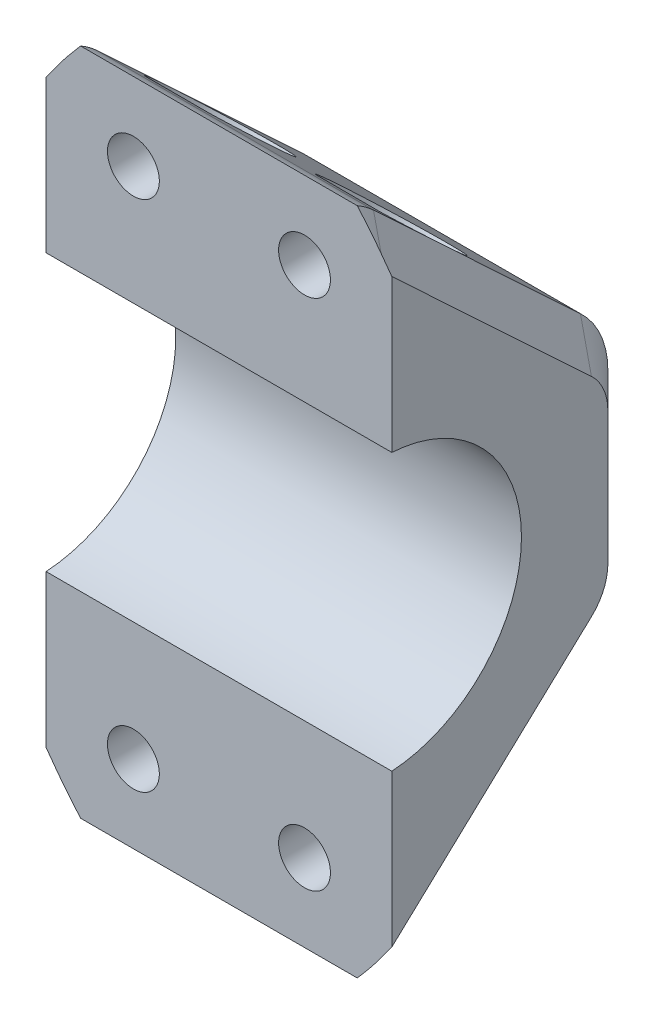
from build123d import *

# Parameters (mm, degrees)
SKETCH2_W           = 20
SKETCH2_H           = 49.6
SKETCH2_R           = 1.5
BOSS_EXTRUDE1_DEPTH = 30
CUT_EXTRUDE1_DEPTH  = 30
CUT_EXTRUDE2_DEPTH  = 22
FILLET1_R           = 5
FILLET2_R           = 2
CHAMFER1_SIZE       = 2
SKETCH5_R           = 3
SKETCH5_R_2         = 1.5
CUT_EXTRUDE3_DEPTH  = 12
CUT_EXTRUDE4_DEPTH  = 23


with BuildPart() as part:
    # Sketch2 → Boss-Extrude1 (new body)
    with BuildSketch(Plane.XY):
        with Locations((20.689228864, 114.541105708)):
            Rectangle(SKETCH2_W, SKETCH2_H)
        with Locations((15.739481395, 99.69135824)):
            Circle(SKETCH2_R, mode=Mode.SUBTRACT)
        with Locations((25.638976332, 99.69135824)):
            Circle(SKETCH2_R, mode=Mode.SUBTRACT)
        with Locations((25.638976332, 129.390853177)):
            Circle(SKETCH2_R, mode=Mode.SUBTRACT)
        with Locations((15.739481395, 129.390853177)):
            Circle(SKETCH2_R, mode=Mode.SUBTRACT)
    extrude(amount=BOSS_EXTRUDE1_DEPTH)

    # Sketch3 → Cut-Extrude1 (cut)
    with BuildSketch(Plane(origin=(30.689228864, 0, 0), x_dir=(0, 0, -1), z_dir=(1, 0, 0))):
        Polygon((-10, 119.541105708), (-18.024193548, 119.541105708), (-11.975806452, 109.541105708), (-10, 109.541105708), align=None)
        Polygon((-11.975806452, 109.541105708), (-18.024193548, 119.541105708), (-20, 119.541105708), (-20, 109.541105708), align=None)
    extrude(amount=-CUT_EXTRUDE1_DEPTH, mode=Mode.SUBTRACT)

    # Sketch4 → Cut-Extrude2 (cut)
    with BuildSketch(Plane(origin=(30.689228864, 0, 0), x_dir=(0, 0, -1), z_dir=(1, 0, 0))):
        Polygon((-30, 139.341105708), (-27.096774194, 134.541105708), (-15, 134.541105708), (0, 134.541105708), (0, 139.341105708), align=None)
        Polygon((-30, 134.541105708), (-27.096774194, 134.541105708), (-30, 139.341105708), align=None)
        Polygon((-15, 134.541105708), (0, 120.541105708), (0, 134.541105708), align=None)
        Polygon((-7.268041237, 101.757600554), (-2.903225806, 94.541105708), (0, 94.541105708), (0, 108.541105708), align=None)
        Polygon((-15, 94.541105708), (-2.903225806, 94.541105708), (-7.268041237, 101.757600554), align=None)
        Polygon((-30, 89.741105708), (0, 89.741105708), (-2.903225806, 94.541105708), (-15, 94.541105708), (-30, 94.541105708), align=None)
        Polygon((-2.903225806, 94.541105708), (0, 89.741105708), (0, 94.541105708), align=None)
    extrude(amount=-CUT_EXTRUDE2_DEPTH, mode=Mode.SUBTRACT)

    # Fillet1
    fillet1_edges = [part.edges().sort_by_distance(p)[0] for p in [
        (20.689228864, 134.541105708, 15),
        (20.689228864, 120.541105708, 0),
        (20.689228864, 94.541105708, 15),
        (20.689228864, 108.541105708, 0),
    ]]
    fillet(fillet1_edges, radius=FILLET1_R)

    # Fillet2
    fillet2_edges = [part.edges().sort_by_distance(p)[0] for p in [
        (20.689228864, 134.541105708, 30),
        (20.689228864, 94.541105708, 30),
    ]]
    fillet(fillet2_edges, radius=FILLET2_R)

    # Chamfer1
    chamfer1_edges = [part.edges().sort_by_distance(p)[0] for p in [
        (30.689228864, 127.610001295, 7.5738167),
        (10.689228864, 127.610001295, 7.5738167),
        (30.689228864, 114.541105708, 0),
        (30.689228864, 101.472210122, 7.5738167),
        (30.689228864, 108.721124919, 0.414263622),
        (30.689228864, 120.361086498, 0.414263622),
        (30.689228864, 94.889418826, 15.137292206),
        (30.689228864, 134.192792591, 15.137292206),
        (10.689228864, 114.541105708, 0),
        (10.689228864, 101.472210122, 7.5738167),
        (10.689228864, 108.721124919, 0.414263622),
        (10.689228864, 120.361086498, 0.414263622),
        (10.689228864, 94.889418826, 15.137292206),
        (10.689228864, 134.192792591, 15.137292206),
        (10.689228864, 114.541105708, 30),
        (30.689228864, 114.541105708, 30),
        (30.689228864, 134.541105708, 22.485407952),
        (30.689228864, 94.541105708, 22.485407952),
        (30.689228864, 133.955319271, 29.414213562),
        (30.689228864, 95.126892146, 29.414213562),
        (10.689228864, 94.541105708, 22.485407952),
        (10.689228864, 134.541105708, 22.485407952),
        (10.689228864, 133.955319271, 29.414213562),
        (10.689228864, 95.126892146, 29.414213562),
    ]]
    chamfer(chamfer1_edges, length=CHAMFER1_SIZE - 0.0001)  # a hair under: the kernel refuses the full size

    # Sketch5 → Cut-Extrude3 (cut)
    # profile 1 of 4: a face of its own
    with BuildSketch(Plane(origin=(0, 0, 0), x_dir=(-1, 0, 0), z_dir=(0, 0, -1))):
        with Locations((-15.739481395, 99.69135824)):
            Circle(SKETCH5_R)
        with Locations((-15.739481395, 99.69135824)):
            Circle(SKETCH5_R_2, mode=Mode.SUBTRACT)
    # profile 2 of 4: a face of its own
    with BuildSketch(Plane(origin=(0, 0, 0), x_dir=(-1, 0, 0), z_dir=(0, 0, -1))):
        with Locations((-25.638976332, 99.69135824)):
            Circle(SKETCH5_R)
        with Locations((-25.638976332, 99.69135824)):
            Circle(SKETCH5_R_2, mode=Mode.SUBTRACT)
    # profile 3 of 4: a face of its own
    with BuildSketch(Plane(origin=(0, 0, 0), x_dir=(-1, 0, 0), z_dir=(0, 0, -1))):
        with Locations((-15.739481395, 129.390853177)):
            Circle(SKETCH5_R)
        with Locations((-15.739481395, 129.390853177)):
            Circle(SKETCH5_R_2, mode=Mode.SUBTRACT)
    # profile 4 of 4: a face of its own
    with BuildSketch(Plane(origin=(0, 0, 0), x_dir=(-1, 0, 0), z_dir=(0, 0, -1))):
        with Locations((-25.638976332, 129.390853177)):
            Circle(SKETCH5_R)
        with Locations((-25.638976332, 129.390853177)):
            Circle(SKETCH5_R_2, mode=Mode.SUBTRACT)
    extrude(amount=-CUT_EXTRUDE3_DEPTH, mode=Mode.SUBTRACT)

    # Sketch6 → Cut-Extrude4 (cut)
    with BuildSketch(Plane.ZY.offset(-10.689228864)):
        with BuildLine():
            ThreePointArc((16.970815903, 96.541105708), (16.478743483, 96.581736733), (16, 96.70252922))
            Line((16, 96.70252922), (16, 91.202832585))
            Line((16, 91.202832585), (39.910531439, 91.202832585))
            Line((39.910531439, 91.202832585), (39.910531439, 137.879378832))
            Line((39.910531439, 137.879378832), (16, 137.879378832))
            Line((16, 137.879378832), (16, 132.379682197))
            ThreePointArc((16, 132.379682197), (16.478743483, 132.500474684), (16.970815903, 132.541105708))
            Line((16.970815903, 132.541105708), (28, 132.541105708))
            Line((28, 132.541105708), (28, 96.541105708))
            Line((28, 96.541105708), (16.970815903, 96.541105708))
        make_face()
        with BuildLine():
            ThreePointArc((23, 114.541105708), (21, 109.249603086), (16, 106.603851775))
            Line((16, 106.603851775), (16, 96.70252922))
            ThreePointArc((16, 96.70252922), (16.478743483, 96.581736733), (16.970815903, 96.541105708))
            Line((16.970815903, 96.541105708), (28, 96.541105708))
            Line((28, 96.541105708), (28, 132.541105708))
            Line((28, 132.541105708), (16.970815903, 132.541105708))
            ThreePointArc((16.970815903, 132.541105708), (16.478743483, 132.500474684), (16, 132.379682197))
            Line((16, 132.379682197), (16, 122.478359641))
            ThreePointArc((16, 122.478359641), (21, 119.83260833), (23, 114.541105708))
        make_face()
        Polygon((20, 119.541105708), (16, 115.541105708), (16, 109.541105708), (20, 109.541105708), align=None)
        Polygon((16, 119.541105708), (16, 115.541105708), (20, 119.541105708), align=None)
        with BuildLine():
            Line((14.5, 109.541105708), (10, 109.541105708))
            Line((10, 109.541105708), (10, 119.541105708))
            Line((10, 119.541105708), (14.5, 119.541105708))
            Line((14.5, 119.541105708), (14.5, 122.52546542))
            ThreePointArc((14.5, 122.52546542), (7, 114.541105708), (14.5, 106.556745997))
            Line((14.5, 106.556745997), (14.5, 109.541105708))
        make_face()
        with BuildLine():
            Line((20, 109.541105708), (16, 109.541105708))
            Line((16, 109.541105708), (16, 106.603851775))
            ThreePointArc((16, 106.603851775), (21, 109.249603086), (23, 114.541105708))
            ThreePointArc((23, 114.541105708), (21, 119.83260833), (16, 122.478359641))
            Line((16, 122.478359641), (16, 119.541105708))
            Line((16, 119.541105708), (20, 119.541105708))
            Line((20, 119.541105708), (20, 109.541105708))
        make_face()
        Polygon((10, 119.541105708), (10, 109.541105708), (14.5, 114.041105708), (14.5, 119.541105708), align=None)
        with BuildLine():
            Line((14.5, 122.52546542), (14.5, 119.541105708))
            Line((14.5, 119.541105708), (15, 119.541105708))
            Line((15, 119.541105708), (15, 122.541105708))
            ThreePointArc((15, 122.541105708), (14.749877721, 122.53719468), (14.5, 122.52546542))
        make_face()
        with BuildLine():
            Line((15, 122.541105708), (15, 119.541105708))
            Line((15, 119.541105708), (16, 119.541105708))
            Line((16, 119.541105708), (16, 122.478359641))
            ThreePointArc((16, 122.478359641), (15.5009833, 122.525403782), (15, 122.541105708))
        make_face()
        Polygon((14.5, 119.541105708), (14.5, 114.041105708), (15, 114.541105708), (15, 119.541105708), align=None)
        Polygon((15, 119.541105708), (15, 114.541105708), (16, 115.541105708), (16, 119.541105708), align=None)
        Polygon((14.5, 114.041105708), (10, 109.541105708), (14.5, 109.541105708), align=None)
        Polygon((15, 114.541105708), (14.5, 114.041105708), (14.5, 109.541105708), (15, 109.541105708), align=None)
        Polygon((16, 115.541105708), (15, 114.541105708), (15, 109.541105708), (16, 109.541105708), align=None)
        with BuildLine():
            Line((15, 109.541105708), (14.5, 109.541105708))
            Line((14.5, 109.541105708), (14.5, 106.556745997))
            ThreePointArc((14.5, 106.556745997), (14.749877721, 106.545016736), (15, 106.541105708))
            Line((15, 106.541105708), (15, 109.541105708))
        make_face()
        with BuildLine():
            Line((16, 109.541105708), (15, 109.541105708))
            Line((15, 109.541105708), (15, 106.541105708))
            ThreePointArc((15, 106.541105708), (15.5009833, 106.556807634), (16, 106.603851775))
            Line((16, 106.603851775), (16, 109.541105708))
        make_face()
        with BuildLine():
            ThreePointArc((15, 106.541105708), (14.749877721, 106.545016736), (14.5, 106.556745997))
            Line((14.5, 106.556745997), (14.5, 97.743543645))
            Line((14.5, 97.743543645), (14.923861152, 97.347939904))
            ThreePointArc((14.923861152, 97.347939904), (14.961637209, 97.313281439), (15, 97.279273558))
            Line((15, 97.279273558), (15, 106.541105708))
        make_face()
        with BuildLine():
            ThreePointArc((16, 106.603851775), (15.5009833, 106.556807634), (15, 106.541105708))
            Line((15, 106.541105708), (15, 97.279273558))
            ThreePointArc((15, 97.279273558), (15.471997059, 96.942347914), (16, 96.70252922))
            Line((16, 96.70252922), (16, 106.603851775))
        make_face()
        with BuildLine():
            Line((14.923861152, 97.347939904), (14.5, 97.743543645))
            Line((14.5, 97.743543645), (14.5, 91.202832585))
            Line((14.5, 91.202832585), (15, 91.202832585))
            Line((15, 91.202832585), (15, 97.279273558))
            ThreePointArc((15, 97.279273558), (14.961637209, 97.313281439), (14.923861152, 97.347939904))
        make_face()
        with BuildLine():
            ThreePointArc((16, 96.70252922), (15.471997059, 96.942347914), (15, 97.279273558))
            Line((15, 97.279273558), (15, 91.202832585))
            Line((15, 91.202832585), (16, 91.202832585))
            Line((16, 91.202832585), (16, 96.70252922))
        make_face()
        with BuildLine():
            Line((14.5, 131.338667771), (14.5, 122.52546542))
            ThreePointArc((14.5, 122.52546542), (14.749877721, 122.53719468), (15, 122.541105708))
            Line((15, 122.541105708), (15, 131.802937859))
            ThreePointArc((15, 131.802937859), (14.961637209, 131.768929978), (14.923861152, 131.734271513))
            Line((14.923861152, 131.734271513), (14.5, 131.338667771))
        make_face()
        with BuildLine():
            Line((15, 131.802937859), (15, 122.541105708))
            ThreePointArc((15, 122.541105708), (15.5009833, 122.525403782), (16, 122.478359641))
            Line((16, 122.478359641), (16, 132.379682197))
            ThreePointArc((16, 132.379682197), (15.471997059, 132.139863502), (15, 131.802937859))
        make_face()
        with BuildLine():
            Line((14.5, 137.879378832), (14.5, 131.338667771))
            Line((14.5, 131.338667771), (14.923861152, 131.734271513))
            ThreePointArc((14.923861152, 131.734271513), (14.961637209, 131.768929978), (15, 131.802937859))
            Line((15, 131.802937859), (15, 137.879378832))
            Line((15, 137.879378832), (14.5, 137.879378832))
        make_face()
        with BuildLine():
            Line((15, 137.879378832), (15, 131.802937859))
            ThreePointArc((15, 131.802937859), (15.471997059, 132.139863502), (16, 132.379682197))
            Line((16, 132.379682197), (16, 137.879378832))
            Line((16, 137.879378832), (15, 137.879378832))
        make_face()
    extrude(amount=-CUT_EXTRUDE4_DEPTH, mode=Mode.SUBTRACT)


solid = part.part
